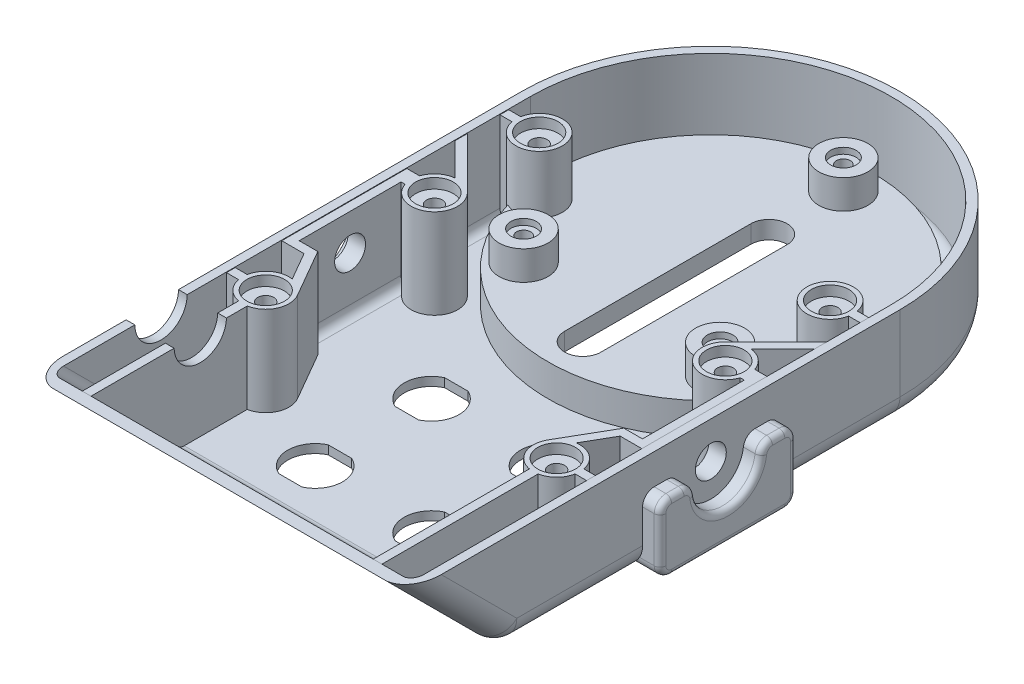
from build123d import *

# Parameters (mm, degrees)
BOSS_EXTRUDE2_DEPTH                            = 21.59
BOSS_EXTRUDE6_DEPTH                            = 41.275
SHELL1_T                                       = -1.905
SKETCH2_R                                      = 35.56
BOSS_EXTRUDE3_DEPTH                            = 4.445
SKETCH4_R                                      = 34.149999899
CUT_EXTRUDE2_DEPTH                             = 5
SKETCH6_R                                      = 5.355
BOSS_EXTRUDE4_DEPTH                            = 8.89
SKETCH35_R                                     = 3.958
CUT_EXTRUDE19_DEPTH                            = 5.668
CBORE_FOR_3_BUTTON_HEAD_CAP_SCREW4_D           = 3.048
CBORE_FOR_3_BUTTON_HEAD_CAP_SCREW4_CBORE_D     = 5.55752
CBORE_FOR_3_BUTTON_HEAD_CAP_SCREW4_CBORE_DEPTH = 1.3208
CUT_EXTRUDE7_DEPTH                             = 120.579115861
CUT_EXTRUDE8_DEPTH                             = 120.108747895
F_1_4_CLEARANCE_HOLE1_D                        = 6.7564
CUT_EXTRUDE12_REACH                            = 115.487
BOSS_EXTRUDE5_REACH                            = 121.885
SKETCH23_R                                     = 4.109999908
CUT_EXTRUDE13_DEPTH                            = 2.204999908
SKETCH27_W                                     = 22.225
SKETCH27_H                                     = 21.463
SKETCH27_R                                     = 3.3782
BOSS_EXTRUDE9_DEPTH                            = 1.905
SKETCH24_R                                     = 1.7272
CUT_EXTRUDE14_DEPTH                            = 9.525
BOSS_EXTRUDE8_DEPTH                            = 3.81
SKETCH36_OUTSIDE_W                             = 185.232
SKETCH36_OUTSIDE_H                             = 58.232
CUT_EXTRUDE20_DEPTH                            = 3.81
BOSS_EXTRUDE10_START                           = 19.558
BOSS_EXTRUDE10_DEPTH                           = 19.558
FILLET2_R                                      = 1.905
FILLET1_R                                      = 5.08
FILLET5_R                                      = 2.54
FILLET6_R                                      = 1.27
SKETCH32_R                                     = 4.109999908
CUT_EXTRUDE17_DEPTH                            = 2.204999908
SKETCH33_R                                     = 1.7272
CUT_EXTRUDE18_DEPTH                            = 9.525
CUT_EXTRUDE21_REACH                            = 143.888
SKETCH37_R                                     = 5.715
BOSS_EXTRUDE11_START                           = 6.35
BOSS_EXTRUDE11_OUTLINE_R                       = 5.355
BOSS_EXTRUDE11_DEPTH                           = 2.54
CUT_EXTRUDE22_START                            = -3
CUT_EXTRUDE22_OUTLINE_R                        = 4.299999909
CUT_EXTRUDE22_DEPTH                            = 3


# Read off the part's stored shape, not the designer's step: Boss-Extrude11, Cut-Extrude22
with BuildPart() as part:
    # Sketch1 → Boss-Extrude2 (new body)
    with BuildSketch(Plane(origin=(0, 0, 0), x_dir=(1, 0, 0), z_dir=(0, 1, 0))):
        with BuildLine():
            Line((-41.275, -88.9), (41.275, -88.9))
            Line((41.275, -88.9), (41.275, -3.175))
            ThreePointArc((41.275, -3.175), (0, 38.1), (-41.275, -3.175))
            Line((-41.275, -3.175), (-41.275, -88.9))
        make_face()
    extrude(amount=BOSS_EXTRUDE2_DEPTH)

    # Sketch19 → Boss-Extrude6 (add, symmetric)
    with BuildSketch(Plane(origin=(0, 0, 0), x_dir=(0, 0, -1), z_dir=(1, 0, 0))):
        Polygon((-88.9, 0), (-88.9, 21.59), (-110.49, 21.59), align=None)
    extrude(amount=BOSS_EXTRUDE6_DEPTH, both=True)

    # Shell1
    shell1_openings = [part.faces().sort_by_distance(p)[0] for p in [
        (0, 21.59, 40.32016302),
    ]]
    offset(amount=SHELL1_T, openings=shell1_openings, kind=Kind.INTERSECTION)

    # Sketch2 → Boss-Extrude3 (add)
    with BuildSketch(Plane(origin=(0, 1.905, 0), x_dir=(1, 0, 0), z_dir=(0, 1, 0))):
        with Locations(Location((0, -3.175, 0), (0, 0, 270))):
            Circle(SKETCH2_R)
    extrude(amount=BOSS_EXTRUDE3_DEPTH)

    # Sketch4 → Cut-Extrude2 (cut)
    with BuildSketch(Plane.XZ):
        with Locations(Location((0, 3.175, 0), (0, 0, 270))):
            Circle(SKETCH4_R)
    extrude(amount=-CUT_EXTRUDE2_DEPTH, mode=Mode.SUBTRACT)

    # Sketch6 → Boss-Extrude4 (add)
    with BuildSketch(Plane(origin=(0, 6.35, 0), x_dir=(1, 0, 0), z_dir=(0, 1, 0))):
        with Locations(Location((0, 25.760469738, 0), (0, 0, 270))):
            Circle(SKETCH6_R)
        with Locations(Location((21.45, -22.595579522, 0), (0, 0, 270))):
            Circle(SKETCH6_R)
        with Locations(Location((-21.45, -22.595579522, 0), (0, 0, 270))):
            Circle(SKETCH6_R)
    extrude(amount=BOSS_EXTRUDE4_DEPTH)

    # Sketch35 → Cut-Extrude19 (cut)
    with BuildSketch(Plane.XZ.offset(-5)):
        with Locations(Location((0, -25.760469738, 0), (0, 0, 270))):
            Circle(SKETCH35_R)
        with Locations(Location((-21.45, 22.595579522, 0), (0, 0, 270))):
            Circle(SKETCH35_R)
        with Locations(Location((21.45, 22.595579522, 0), (0, 0, 270))):
            Circle(SKETCH35_R)
    extrude(amount=-CUT_EXTRUDE19_DEPTH, mode=Mode.SUBTRACT)

    # CBORE for #3 Button Head Cap Screw4 (through all)
    with Locations(Plane(origin=(21.45, 15.24, 22.595579522), x_dir=(0, 0, 1), z_dir=(0, 1, 0))):
        with Locations((0, 0), (0, -42.9), (-48.35604926, -21.45)):
            CounterBoreHole(CBORE_FOR_3_BUTTON_HEAD_CAP_SCREW4_D / 2, CBORE_FOR_3_BUTTON_HEAD_CAP_SCREW4_CBORE_D / 2, CBORE_FOR_3_BUTTON_HEAD_CAP_SCREW4_CBORE_DEPTH)

    # Sketch14 → Cut-Extrude7 (cut, through all)
    with BuildSketch(Plane(origin=(0, 1.905, 0), x_dir=(1, 0, 0), z_dir=(0, 1, 0))):
        with BuildLine():
            Line((-15.253868379, -82.255499954), (-10.146131621, -82.255499954))
            ThreePointArc((-10.146131621, -82.255499954), (-6.708000046, -76.835), (-10.146131621, -71.414500046))
            Line((-10.146131621, -71.414500046), (-15.253868379, -71.414500046))
            ThreePointArc((-15.253868379, -71.414500046), (-18.691999954, -76.835), (-15.253868379, -82.255499954))
        make_face()
        with BuildLine():
            Line((-15.253868379, -56.855499954), (-10.146131621, -56.855499954))
            ThreePointArc((-10.146131621, -56.855499954), (-6.708000046, -51.435), (-10.146131621, -46.014500046))
            Line((-10.146131621, -46.014500046), (-15.253868379, -46.014500046))
            ThreePointArc((-15.253868379, -46.014500046), (-18.691999954, -51.435), (-15.253868379, -56.855499954))
        make_face()
        with BuildLine():
            Line((15.253868379, -82.255499954), (10.146131621, -82.255499954))
            ThreePointArc((10.146131621, -82.255499954), (6.708000046, -76.835), (10.146131621, -71.414500046))
            Line((10.146131621, -71.414500046), (15.253868379, -71.414500046))
            ThreePointArc((15.253868379, -71.414500046), (18.691999954, -76.835), (15.253868379, -82.255499954))
        make_face()
        with BuildLine():
            Line((15.253868379, -56.855499954), (10.146131621, -56.855499954))
            ThreePointArc((10.146131621, -56.855499954), (6.708000046, -51.435), (10.146131621, -46.014500046))
            Line((10.146131621, -46.014500046), (15.253868379, -46.014500046))
            ThreePointArc((15.253868379, -46.014500046), (18.691999954, -51.435), (15.253868379, -56.855499954))
        make_face()
    extrude(amount=-CUT_EXTRUDE7_DEPTH, mode=Mode.SUBTRACT)

    # Sketch15 → Cut-Extrude8 (cut, through all)
    with BuildSketch(Plane.XZ.offset(-5)):
        with BuildLine():
            Line((3.959999954, 31.115), (3.959999954, -9.525))
            ThreePointArc((3.959999954, -9.525), (0, -13.484999954), (-3.959999954, -9.525))
            Line((-3.959999954, -9.525), (-3.959999954, 31.115))
            ThreePointArc((-3.959999954, 31.115), (0, 35.074999954), (3.959999954, 31.115))
        make_face()
    extrude(amount=-CUT_EXTRUDE8_DEPTH, mode=Mode.SUBTRACT)

    # 1/4 Clearance Hole1 (through all)
    with Locations(Plane(origin=(41.275, 13.589, 44.45), x_dir=(0, 0, 1), z_dir=(1, 0, 0))):
        with Locations((0, 0)):
            Hole(F_1_4_CLEARANCE_HOLE1_D / 2)

    # Sketch20 → Cut-Extrude12 (cut, up to next)
    with BuildSketch(Plane(origin=(0, -44.45, 44.45), x_dir=(1, 0, 0), z_dir=(0, -0.7071067811865516, 0.7071067811865435)), mode=Mode.PRIVATE) as cut_extrude12_sk1:
        with BuildLine():
            Line((5.15927933, 72.225779566), (5.902448688, 72.968948923))
            Line((5.902448688, 72.968948923), (6.049526963, 72.821870647))
            ThreePointArc((6.049526963, 72.821870647), (-5.690088203, 83.818316456), (5.306357606, 72.07870129))
            Line((5.306357606, 72.07870129), (5.15927933, 72.225779566))
        make_face()
    cut_extrude12_tool1 = extrude(cut_extrude12_sk1.sketch, amount=-CUT_EXTRUDE12_REACH, mode=Mode.PRIVATE) & part.part
    add(cut_extrude12_tool1.solids().sort_by_distance((-0.006366, 10.799501, 99.699501))[0], mode=Mode.SUBTRACT)

    # Sketch18 → Boss-Extrude5 (add, up to next)
    with BuildSketch(Plane(origin=(0, 21.463, 0), x_dir=(1, 0, 0), z_dir=(0, 1, 0)), mode=Mode.PRIVATE) as boss_extrude5_sk1:
        with BuildLine():
            Line((30.7975, -73.569904182), (30.7975, -107.795923164))
            Line((30.7975, -107.795923164), (32.7025, -107.795923164))
            Line((32.7025, -107.795923164), (32.7025, -73.569904182))
            ThreePointArc((32.7025, -73.569904182), (35.342102448, -72.172102448), (36.739904182, -69.5325))
            Line((36.739904182, -69.5325), (39.37, -69.5325))
            Line((39.37, -69.5325), (39.37, -67.6275))
            Line((39.37, -67.6275), (36.739904182, -67.6275))
            ThreePointArc((36.739904182, -67.6275), (28.157897552, -64.987897552), (30.7975, -73.569904182))
        make_face()
    boss_extrude5_tool1 = extrude(boss_extrude5_sk1.sketch, amount=-BOSS_EXTRUDE5_REACH, mode=Mode.PRIVATE) - part.part
    # Sketch18 → Boss-Extrude5 (add, up to next)
    with BuildSketch(Plane(origin=(0, 21.463, 0), x_dir=(1, 0, 0), z_dir=(0, 1, 0)), mode=Mode.PRIVATE) as boss_extrude5_sk2:
        with BuildLine():
            Line((36.739904182, -7.9375), (39.37, -7.9375))
            Line((39.37, -7.9375), (39.37, -9.8425))
            Line((39.37, -9.8425), (36.739904182, -9.8425))
            ThreePointArc((36.739904182, -9.8425), (26.67, -8.89), (36.739904182, -7.9375))
        make_face()
    boss_extrude5_tool2 = extrude(boss_extrude5_sk2.sketch, amount=-BOSS_EXTRUDE5_REACH, mode=Mode.PRIVATE) - part.part
    boss_extrude5_1 = boss_extrude5_tool1.solids().sort_by_distance((31.955315, 21.463, 78.116579))[0]
    add(boss_extrude5_1)
    boss_extrude5_2 = boss_extrude5_tool2.solids().sort_by_distance((32.110756, 21.463, 8.89))[0]
    add(boss_extrude5_2)
    boss_extrude5 = boss_extrude5_1 + boss_extrude5_2  # Boss-Extrude5 as one shape, for the pattern or mirror that repeats it

    # Sketch23 → Cut-Extrude13 (cut)
    with BuildSketch(Plane(origin=(0, 21.463, 0), x_dir=(1, 0, 0), z_dir=(0, 1, 0))):
        with Locations(Location((31.75, -68.58, 0), (0, 0, 270))):
            Circle(SKETCH23_R)
        with Locations(Location((31.75, -8.89, 0), (0, 0, 90))):
            Circle(SKETCH23_R)
    cut_extrude13 = extrude(amount=-CUT_EXTRUDE13_DEPTH, mode=Mode.SUBTRACT)

    # Mirror9: Boss-Extrude5, Cut-Extrude13 across plane
    add(boss_extrude5.mirror(Plane(origin=(0, 0, 0), x_dir=(0, 0, 1), z_dir=(1, 0, 0))))
    add(cut_extrude13.mirror(Plane(origin=(0, 0, 0), x_dir=(0, 0, 1), z_dir=(1, 0, 0))), mode=Mode.SUBTRACT)

    # Sketch27 → Boss-Extrude9 (add)
    with BuildSketch(Plane(origin=(-39.37, 0, 0), x_dir=(0, 0, -1), z_dir=(1, 0, 0))):
        with Locations((-44.45, 10.7315)):
            Rectangle(SKETCH27_W, SKETCH27_H)
        with Locations((-44.45, 13.589)):
            Circle(SKETCH27_R, mode=Mode.SUBTRACT)
    boss_extrude9 = extrude(amount=BOSS_EXTRUDE9_DEPTH)

    # Mirror4: Boss-Extrude9 across plane
    add(boss_extrude9.mirror(Plane(origin=(0, 0, 0), x_dir=(0, 0, 1), z_dir=(1, 0, 0))))

    # Sketch24 → Cut-Extrude14 (cut)
    with BuildSketch(Plane(origin=(0, 19.258000092, 0), x_dir=(1, 0, 0), z_dir=(0, 1, 0))):
        with Locations(Location((-31.75, -8.89, 0), (0, 0, 270))):
            Circle(SKETCH24_R)
        with Locations(Location((31.75, -8.89, 0), (0, 0, 270))):
            Circle(SKETCH24_R)
        with Locations(Location((31.75, -68.58, 0), (0, 0, 270))):
            Circle(SKETCH24_R)
        with Locations(Location((-31.75, -68.58, 0), (0, 0, 270))):
            Circle(SKETCH24_R)
    extrude(amount=-CUT_EXTRUDE14_DEPTH, mode=Mode.SUBTRACT)

    # Sketch25 → Boss-Extrude8 (add)
    with BuildSketch(Plane.ZY.offset(41.275)):
        with BuildLine():
            Line((51.3207, 15.24), (59.644000092, 15.24))
            Line((59.644000092, 15.24), (59.644000092, 0))
            Line((59.644000092, 0), (29.255999908, 0))
            Line((29.255999908, 0), (29.255999908, 15.24))
            Line((29.255999908, 15.24), (37.5793, 15.24))
            Line((37.5793, 15.24), (37.5793, 13.589))
            ThreePointArc((37.5793, 13.589), (44.45, 6.7183), (51.3207, 13.589))
            Line((51.3207, 13.589), (51.3207, 15.24))
        make_face()
    boss_extrude8 = extrude(amount=BOSS_EXTRUDE8_DEPTH)

    # Sketch36 outside → Cut-Extrude20 (cut)
    with BuildSketch(Plane.ZY.offset(45.085)):
        with Locations((36.195, 10.795)):
            Rectangle(SKETCH36_OUTSIDE_W, SKETCH36_OUTSIDE_H)
        with BuildLine():
            Line((59.344000184, 0), (59.344000184, 14.940000092))
            Line((59.344000184, 14.940000092), (51.620699908, 14.940000092))
            Line((51.620699908, 14.940000092), (51.620699908, 13.589))
            ThreePointArc((51.620699908, 13.589), (44.45, 6.418300092), (37.279300092, 13.589))
            Line((37.279300092, 13.589), (37.279300092, 14.940000092))
            Line((37.279300092, 14.940000092), (29.555999816, 14.940000092))
            Line((29.555999816, 14.940000092), (29.555999816, 0))
            Line((29.555999816, 0), (59.344000184, 0))
        make_face(mode=Mode.SUBTRACT)
    cut_extrude20 = extrude(amount=-CUT_EXTRUDE20_DEPTH, mode=Mode.SUBTRACT)

    # Mirror1: Boss-Extrude8, Cut-Extrude20 across plane
    add(boss_extrude8.mirror(Plane(origin=(0, 0, 0), x_dir=(0, 0, 1), z_dir=(1, 0, 0))))
    add(cut_extrude20.mirror(Plane(origin=(0, 0, 0), x_dir=(0, 0, 1), z_dir=(1, 0, 0))), mode=Mode.SUBTRACT)

    # Sketch31 → Boss-Extrude10 (add)
    with BuildSketch(Plane(origin=(0, 1.905, 0), x_dir=(1, 0, 0), z_dir=(0, 1, 0)).offset(BOSS_EXTRUDE10_START)):
        with BuildLine():
            Line((-39.37, -33.3375), (-36.575582219, -33.3375))
            ThreePointArc((-36.575582219, -33.3375), (-29.087775654, -36.076541521), (-28.157897552, -28.157897552))
            Line((-28.157897552, -28.157897552), (-39.37, -16.945795103))
            Line((-39.37, -16.945795103), (-39.37, -19.639871939))
            Line((-39.37, -19.639871939), (-32.309020045, -26.700851895))
            ThreePointArc((-32.309020045, -26.700851895), (-34.950662007, -27.80510929), (-36.575582219, -30.1625))
            Line((-36.575582219, -30.1625), (-39.37, -30.1625))
            Line((-39.37, -30.1625), (-39.37, -33.3375))
        make_face()
        with BuildLine():
            Line((-39.37, -55.5625), (-33.399778394, -55.5625))
            Line((-33.399778394, -55.5625), (-27.350590949, -66.04))
            ThreePointArc((-27.350590949, -66.04), (-28.884278534, -64.38547494), (-30.983156207, -63.55821241))
            Line((-30.983156207, -63.55821241), (-34.499630657, -57.4675))
            Line((-34.499630657, -57.4675), (-39.37, -57.4675))
            Line((-39.37, -57.4675), (-39.37, -55.5625))
        make_face()
    boss_extrude10 = extrude(amount=-BOSS_EXTRUDE10_DEPTH)

    # Fillet2
    fillet2_edges = [part.edges().sort_by_distance(p)[0] for p in [
        (39.37, 1.905, 61.595),
        (39.37, 1.905, 21.59),
        (39.37, 1.905, 5.55625),
        (39.37, 11.7475, 97.953423164),
        (39.37, 1.905, 78.821711582),
        (36.03625, 1.905, 88.110923164),
        (0, 1.905, 88.110923164),
        (-36.03625, 1.905, 88.110923164),
        (-39.37, 11.7475, 97.953423164),
        (-39.37, 1.905, 5.55625),
        (-39.37, 1.905, 13.394147552),
        (-39.37, 1.905, 24.90118597),
        (-39.37, 1.905, 62.5475),
        (-39.37, 1.905, 78.821711582),
        (0, 1.905, -36.195),
        (37.465, 1.905, 44.45),
        (-37.465, 1.905, 44.45),
    ]]
    fillet(fillet2_edges, radius=FILLET2_R)

    # Fillet1
    fillet1_edges = [part.edges().sort_by_distance(p)[0] for p in [
        (-41.275, 10.795, 99.695),
        (41.275, 10.795, 99.695),
        (-41.275, 0, 16.365499908),
        (41.275, 0, 16.365499908),
        (-41.275, 0, 74.122000092),
        (0, 0, -38.1),
        (41.275, 0, 74.122000092),
        (0, 0, 88.9),
    ]]
    fillet(fillet1_edges, radius=FILLET1_R)

    # Fillet5
    fillet5_edges = [part.edges().sort_by_distance(p)[0] for p in [
        (-43.18, 14.940000092, 59.344000184),
        (-43.18, 14.940000092, 51.620699908),
        (-43.18, 14.940000092, 37.279300092),
        (-43.18, 14.940000092, 29.555999816),
        (-40.64, 0, 29.555999816),
        (-40.64, 0, 59.344000184),
        (40.64, 0, 59.344000184),
        (43.18, 14.940000092, 59.344000184),
        (43.18, 14.940000092, 51.620699908),
        (43.18, 14.940000092, 37.279300092),
        (43.18, 14.940000092, 29.555999816),
        (40.64, 0, 29.555999816),
    ]]
    fillet(fillet5_edges, radius=FILLET5_R)

    # Fillet6
    fillet6_edges = [part.edges().sort_by_distance(p)[0] for p in [
        (45.085, 7.470000046, 59.344000184),
        (45.085, 0, 44.45),
        (45.085, 7.470000046, 29.555999816),
        (45.085, 14.940000092, 33.454183354),
        (45.085, 6.418300092, 44.45),
        (45.085, 14.940000092, 55.445816646),
        (45.085, 0.743948776, 30.299948592),
        (45.085, 14.196051316, 30.299948592),
        (45.085, 14.302833295, 36.494872703),
        (45.085, 14.302833295, 52.405127297),
        (45.085, 14.196051316, 58.600051408),
        (45.085, 0.743948776, 58.600051408),
        (-45.085, 0, 44.45),
        (-45.085, 7.470000046, 59.344000184),
        (-45.085, 14.940000092, 33.454183354),
        (-45.085, 7.470000046, 29.555999816),
        (-45.085, 14.940000092, 55.445816646),
        (-45.085, 6.418300092, 44.45),
        (-45.085, 0.743948776, 58.600051408),
        (-45.085, 0.743948776, 30.299948592),
        (-45.085, 14.196051316, 30.299948592),
        (-45.085, 14.302833295, 36.494872703),
        (-45.085, 14.302833295, 52.405127297),
        (-45.085, 14.196051316, 58.600051408),
    ]]
    fillet(fillet6_edges, radius=FILLET6_R)

    # Mirror8: Boss-Extrude10 across plane
    add(boss_extrude10.mirror(Plane(origin=(0, 0, 0), x_dir=(0, 0, 1), z_dir=(1, 0, 0))))

    # Sketch32 → Cut-Extrude17 (cut)
    with BuildSketch(Plane(origin=(0, 21.463, 0), x_dir=(1, 0, 0), z_dir=(0, 1, 0))):
        with Locations(Location((-31.75, -31.75, 0), (0, 0, 270))):
            Circle(SKETCH32_R)
        with Locations(Location((31.75, -31.75, 0), (0, 0, 270))):
            Circle(SKETCH32_R)
    extrude(amount=-CUT_EXTRUDE17_DEPTH, mode=Mode.SUBTRACT)

    # Sketch33 → Cut-Extrude18 (cut)
    with BuildSketch(Plane(origin=(0, 19.258000092, 0), x_dir=(1, 0, 0), z_dir=(0, 1, 0))):
        with Locations(Location((-31.75, -31.75, 0), (0, 0, 270))):
            Circle(SKETCH33_R)
        with Locations(Location((31.75, -31.75, 0), (0, 0, 270))):
            Circle(SKETCH33_R)
    extrude(amount=-CUT_EXTRUDE18_DEPTH, mode=Mode.SUBTRACT)

    # Sketch37 → Cut-Extrude21 (cut, up to next)
    with BuildSketch(Plane.ZY.offset(41.275), mode=Mode.PRIVATE) as cut_extrude21_sk1:
        with Locations((83.82, 21.59)):
            Circle(SKETCH37_R)
    cut_extrude21_tool1 = extrude(cut_extrude21_sk1.sketch, amount=-CUT_EXTRUDE21_REACH, mode=Mode.PRIVATE) & part.part
    add(cut_extrude21_tool1.solids().sort_by_distance((-41.275, 21.59, 83.82))[0], mode=Mode.SUBTRACT)
    add(cut_extrude21_tool1.solids().sort_by_distance((-41.275, 21.59, 83.82))[1], mode=Mode.SUBTRACT)

    # Boss-Extrude11 outline → Boss-Extrude11 (add)
    with BuildSketch(Plane(origin=(0, 0, 0), x_dir=(1, 0, 0), z_dir=(0, 1, 0)).offset(BOSS_EXTRUDE11_START)):
        with BuildLine():
            ThreePointArc((35.487208798, -5.449117788), (0, 32.385), (-35.487208798, -5.449117788))
            ThreePointArc((-35.487208798, -5.449117788), (-26.750348714, -7.990062768), (-34.052795076, -13.41808291))
            ThreePointArc((-34.052795076, -13.41808291), (0, -38.735), (34.052795076, -13.41808291))
            ThreePointArc((34.052795076, -13.41808291), (26.750348714, -7.990062768), (35.487208798, -5.449117788))
        make_face()
        with Locations((-21.45, -22.595579522)):
            Circle(BOSS_EXTRUDE11_OUTLINE_R, mode=Mode.SUBTRACT)
        with Locations((21.45, -22.595579522)):
            Circle(BOSS_EXTRUDE11_OUTLINE_R, mode=Mode.SUBTRACT)
        with BuildLine():
            Line((3.959999954, 9.525), (3.959999954, -31.115))
            ThreePointArc((3.959999954, -31.115), (0, -35.074999954), (-3.959999954, -31.115))
            Line((-3.959999954, -31.115), (-3.959999954, 9.525))
            ThreePointArc((-3.959999954, 9.525), (0, 13.484999954), (3.959999954, 9.525))
        make_face(mode=Mode.SUBTRACT)
        with Locations((0, 25.760469738)):
            Circle(BOSS_EXTRUDE11_OUTLINE_R, mode=Mode.SUBTRACT)
    extrude(amount=BOSS_EXTRUDE11_DEPTH)

    # Cut-Extrude22 outline → Cut-Extrude22 (cut)
    with BuildSketch(Plane.XZ.offset(-5).offset(CUT_EXTRUDE22_START)):
        with Locations((28.75, -0.735629279)):
            Circle(CUT_EXTRUDE22_OUTLINE_R)
        with BuildLine():
            Line((-21.49299527, -4.148974995), (-15.74299527, -8.911850772))
            ThreePointArc((-15.74299527, -8.911850772), (-9.688508468, -8.34335451), (-10.25700473, -2.288867708))
            Line((-10.25700473, -2.288867708), (-16.00700473, 2.474008069))
            ThreePointArc((-16.00700473, 2.474008069), (-22.061491532, 1.905511807), (-21.49299527, -4.148974995))
        make_face()
        with Locations((17, 12.044189565)):
            Circle(CUT_EXTRUDE22_OUTLINE_R)
        with Locations((26.9, 14.049075655)):
            Circle(CUT_EXTRUDE22_OUTLINE_R)
        with Locations((-28.75, -0.735629279)):
            Circle(CUT_EXTRUDE22_OUTLINE_R)
        with Locations((-26.9, 14.049075655)):
            Circle(CUT_EXTRUDE22_OUTLINE_R)
        with Locations((13, -5.60035924)):
            Circle(CUT_EXTRUDE22_OUTLINE_R)
    extrude(amount=CUT_EXTRUDE22_DEPTH, mode=Mode.SUBTRACT)


solid = part.part
